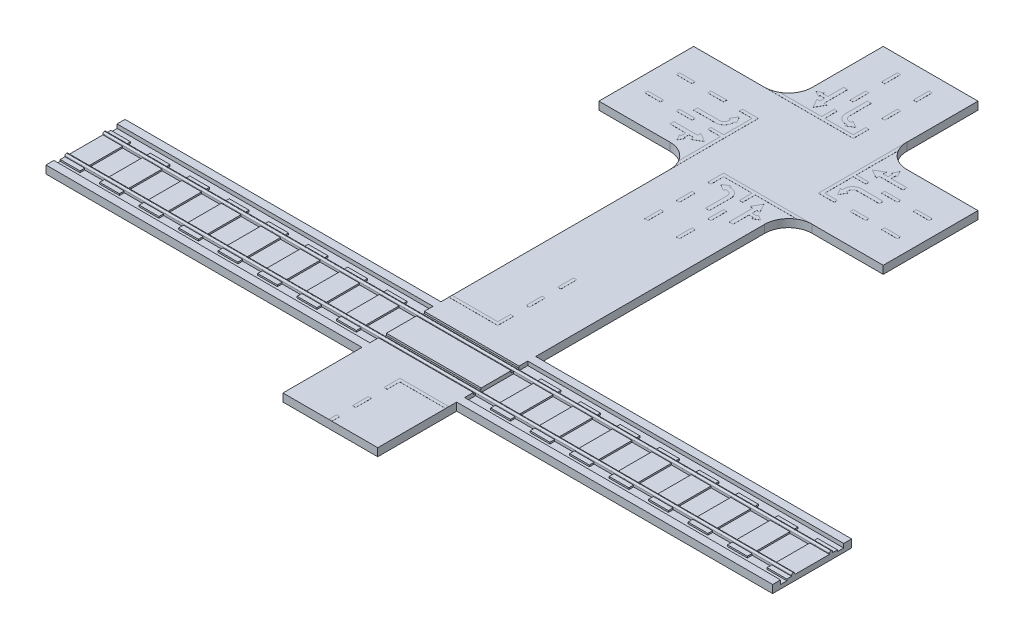
from build123d import *

# Parameters (mm, degrees)
AUFSATZ_LINEAR_AUSTRAGEN1_DEPTH  = 5
VERRUNDUNG1_R                    = 15
SKIZZE2_W                        = 2
SKIZZE2_H                        = 10
SKIZZE2_W_2                      = 10
SKIZZE2_H_2                      = 2
AUFSATZ_LINEAR_AUSTRAGEN2_DEPTH  = 0.05
AUFSATZ_LINEAR_START             = 0.05
AUFSATZ_LINEAR_AUSTRAGEN8_DEPTH  = 0.05
SKIZZE4_W                        = 22
SKIZZE4_H                        = 2
AUFSATZ_LINEAR_AUSTRAGEN13_DEPTH = 0.05
AUFSATZ_LINEAR_AUSTRAGEN14_DEPTH = 0.05
AUFSATZ_LINEAR_AUSTRAGEN15_DEPTH = 5
SKIZZE10_W                       = 29
SKIZZE10_H                       = 2
SKIZZE10_W_2                     = 2
SKIZZE10_H_2                     = 8
SKIZZE10_H_3                     = 10
SKIZZE10_H_4                     = 5
AUFSATZ_LINEAR_AUSTRAGEN17_DEPTH = 0.05
SKIZZE11_W                       = 2
SKIZZE11_H                       = 10
AUFSATZ_LINEAR_AUSTRAGEN18_DEPTH = 0.05
SKIZZE12_W                       = 200
SKIZZE12_H                       = 40
SCHNITT_LINEAR_AUSTRAGEN1_DEPTH  = 2.5
SKIZZE16_W                       = 200
SKIZZE16_H                       = 2
AUFSATZ_LINEAR_AUSTRAGEN20_DEPTH = 2.5
SKIZZE17_W                       = 60
SKIZZE17_H                       = 1.5
SCHNITT_LINEAR_AUSTRAGEN3_DEPTH  = 1.25
SKIZZE18_W                       = 12.5
SKIZZE18_H                       = 32
AUFSATZ_LINEAR_AUSTRAGEN22_DEPTH = 1
VERRUNDUNG2_R                    = 1
VERRUNDUNG3_R                    = 0.25


with BuildPart() as part:
    # Skizze1 → Aufsatz-Linear austragen1 (new body)
    with BuildSketch(Plane(origin=(0, 0, 0), x_dir=(1, 0, 0), z_dir=(0, 1, 0))):
        Polygon((-60, 0), (-120, 0), (-120, 60), (-180, 60), (-180, 120), (-120, 120), (-120, 180), (-60, 180), (-60, 120), (0, 120), (0, 60), (-60, 60), align=None)
    extrude(amount=AUFSATZ_LINEAR_AUSTRAGEN1_DEPTH)

    # Verrundung1
    verrundung1_edges = [part.edges().sort_by_distance(p)[0] for p in [
        (-60, 2.5, -120),
        (-60, 2.5, -60),
        (-120, 2.5, -60),
        (-120, 2.5, -120),
    ]]
    fillet(verrundung1_edges, radius=VERRUNDUNG1_R)

    # Skizze2 → Aufsatz-Linear austragen2 (add)
    with BuildSketch(Plane(origin=(0, 5, 0), x_dir=(1, 0, 0), z_dir=(0, 1, 0))):
        with Locations((-100, 55)):
            Rectangle(SKIZZE2_W, SKIZZE2_H)
        with Locations((-100, 35)):
            Rectangle(SKIZZE2_W, SKIZZE2_H)
        with Locations((-100, 15)):
            Rectangle(SKIZZE2_W, SKIZZE2_H)
        with Locations((-80, 15)):
            Rectangle(SKIZZE2_W, SKIZZE2_H)
        with Locations((-80, 35)):
            Rectangle(SKIZZE2_W, SKIZZE2_H)
        with Locations((-80, 55)):
            Rectangle(SKIZZE2_W, SKIZZE2_H)
        with Locations((-55, 80)):
            Rectangle(SKIZZE2_W_2, SKIZZE2_H_2)
        with Locations((-35, 80)):
            Rectangle(SKIZZE2_W_2, SKIZZE2_H_2)
        with Locations((-15, 80)):
            Rectangle(SKIZZE2_W_2, SKIZZE2_H_2)
        with Locations((-15, 100)):
            Rectangle(SKIZZE2_W_2, SKIZZE2_H_2)
        with Locations((-35, 100)):
            Rectangle(SKIZZE2_W_2, SKIZZE2_H_2)
        with Locations((-55, 100)):
            Rectangle(SKIZZE2_W_2, SKIZZE2_H_2)
        with Locations((-125, 100)):
            Rectangle(SKIZZE2_W_2, SKIZZE2_H_2)
        with Locations((-145, 100)):
            Rectangle(SKIZZE2_W_2, SKIZZE2_H_2)
        with Locations((-165, 100)):
            Rectangle(SKIZZE2_W_2, SKIZZE2_H_2)
        with Locations((-165, 80)):
            Rectangle(SKIZZE2_W_2, SKIZZE2_H_2)
        with Locations((-145, 80)):
            Rectangle(SKIZZE2_W_2, SKIZZE2_H_2)
        with Locations((-125, 80)):
            Rectangle(SKIZZE2_W_2, SKIZZE2_H_2)
        with Locations((-80, 125)):
            Rectangle(SKIZZE2_W, SKIZZE2_H)
        with Locations((-80, 145)):
            Rectangle(SKIZZE2_W, SKIZZE2_H)
        with Locations((-80, 165)):
            Rectangle(SKIZZE2_W, SKIZZE2_H)
        with Locations((-100, 165)):
            Rectangle(SKIZZE2_W, SKIZZE2_H)
        with Locations((-100, 145)):
            Rectangle(SKIZZE2_W, SKIZZE2_H)
        with Locations((-100, 125)):
            Rectangle(SKIZZE2_W, SKIZZE2_H)
    extrude(amount=AUFSATZ_LINEAR_AUSTRAGEN2_DEPTH)

    # Skizze3 → Aufsatz-Linear austragen8 (add)
    with BuildSketch(Plane(origin=(0, 5, 0), x_dir=(1, 0, 0), z_dir=(0, 1, 0)).offset(AUFSATZ_LINEAR_START)):
        with BuildLine():
            Line((-81, 60), (-81, 58))
            Line((-81, 58), (-52.483314774, 58))
            ThreePointArc((-52.483314774, 58), (-48.872983346, 59.491376746), (-45, 60))
            Line((-45, 60), (-81, 60))
        make_face()
        Polygon((-67, 47), (-70, 47), (-70, 50), (-68, 50), (-71.25, 55.629165125), (-74.5, 50), (-72.5, 50), (-72.5, 35), (-70, 35), (-70, 45), (-67, 45), (-67, 44), (-63.535898385, 46), (-67, 48), align=None)
    extrude(amount=-AUFSATZ_LINEAR_AUSTRAGEN8_DEPTH)

    # Skizze4 → Aufsatz-Linear austragen13 (add)
    with BuildSketch(Plane(origin=(0, 5, 0), x_dir=(1, 0, 0), z_dir=(0, 1, 0))):
        with BuildLine():
            ThreePointArc((-87.5, 48.63), (-88.378679656, 50.751320344), (-90.5, 51.63))
            Line((-90.5, 51.63), (-91.5, 51.63))
            Line((-91.5, 51.63), (-91.5, 50.38))
            Line((-91.5, 50.38), (-95.830127019, 52.88))
            Line((-95.830127019, 52.88), (-91.5, 55.38))
            Line((-91.5, 55.38), (-91.5, 54.13))
            Line((-91.5, 54.13), (-90.5, 54.13))
            ThreePointArc((-90.5, 54.13), (-86.610912703, 52.519087297), (-85, 48.63))
            Line((-85, 48.63), (-85, 35))
            Line((-85, 35), (-87.5, 35))
            Line((-87.5, 35), (-87.5, 48.63))
        make_face()
        with Locations((-90, 59)):
            Rectangle(SKIZZE4_W, SKIZZE4_H)
    extrude(amount=AUFSATZ_LINEAR_AUSTRAGEN13_DEPTH)

    # Skizze8 → Aufsatz-Linear austragen14 (add)
    with BuildSketch(Plane(origin=(0, 5, 0), x_dir=(1, 0, 0), z_dir=(0, 1, 0)).offset(AUFSATZ_LINEAR_START)):
        Polygon((-108.763026989, 124.393398282), (-108.736973011, 124.393398282), (-105.5, 130), (-107.5, 130), (-107.5, 145), (-110, 145), (-110, 135), (-113, 135), (-113, 136), (-116.464101615, 134), (-113, 132), (-113, 133), (-110, 133), (-110, 130), (-112, 130), align=None)
        with BuildLine():
            Line((-122, 122), (-127.516685226, 122))
            ThreePointArc((-127.516685226, 122), (-131.127016654, 120.508623254), (-135, 120))
            Line((-135, 120), (-79, 120))
            Line((-79, 120), (-79, 122))
            Line((-79, 122), (-122, 122))
        make_face()
        with BuildLine():
            Line((-88.5, 124.393398282), (-88.460919033, 124.393398282))
            Line((-88.460919033, 124.393398282), (-84.169872981, 126.870834875))
            Line((-84.169872981, 126.870834875), (-88.5, 129.370834875))
            Line((-88.5, 129.370834875), (-88.5, 128.120834875))
            Line((-88.5, 128.120834875), (-89.5, 128.120834875))
            ThreePointArc((-89.5, 128.120834875), (-91.621320344, 128.999514532), (-92.5, 131.120834875))
            Line((-92.5, 131.120834875), (-92.5, 145))
            Line((-92.5, 145), (-95, 145))
            Line((-95, 145), (-95, 131.120834875))
            ThreePointArc((-95, 131.120834875), (-93.389087297, 127.231747579), (-89.5, 125.620834875))
            Line((-89.5, 125.620834875), (-88.5, 125.620834875))
            Line((-88.5, 125.620834875), (-88.5, 124.393398282))
        make_face()
        Polygon((-35, 110), (-35, 107.5), (-50, 107.5), (-50, 105.5), (-55.629165125, 108.75), (-50, 112), (-50, 110), (-47, 110), (-47, 113), (-48, 113), (-46, 116.464101615), (-44, 113), (-45, 113), (-45, 110), align=None)
        with BuildLine():
            Line((-58, 79), (-58, 127.516685226))
            ThreePointArc((-58, 127.516685226), (-59.491376746, 131.127016654), (-60, 135))
            Line((-60, 135), (-60, 79))
            Line((-60, 79), (-58, 79))
        make_face()
        with BuildLine():
            Line((-48.879165125, 95), (-35, 95))
            Line((-35, 95), (-35, 92.5))
            Line((-35, 92.5), (-48.879165125, 92.5))
            ThreePointArc((-48.879165125, 92.5), (-51.000485468, 91.621320344), (-51.879165125, 89.5))
            Line((-51.879165125, 89.5), (-51.879165125, 88.5))
            Line((-51.879165125, 88.5), (-50.629165125, 88.5))
            Line((-50.629165125, 88.5), (-53.129165125, 84.169872981))
            Line((-53.129165125, 84.169872981), (-55.629165125, 88.5))
            Line((-55.629165125, 88.5), (-54.379165125, 88.5))
            Line((-54.379165125, 88.5), (-54.379165125, 89.5))
            ThreePointArc((-54.379165125, 89.5), (-52.768252421, 93.389087297), (-48.879165125, 95))
        make_face()
        with BuildLine():
            ThreePointArc((-120, 45), (-120.508623254, 48.872983346), (-122, 52.483314774))
            Line((-122, 52.483314774), (-122, 101))
            Line((-122, 101), (-120, 101))
            Line((-120, 101), (-120, 45))
        make_face()
        with BuildLine():
            Line((-131.120834875, 85), (-145, 85))
            Line((-145, 85), (-145, 87.5))
            Line((-145, 87.5), (-131.120834875, 87.5))
            ThreePointArc((-131.120834875, 87.5), (-128.999514532, 88.378679656), (-128.120834875, 90.5))
            Line((-128.120834875, 90.5), (-128.120834875, 91.5))
            Line((-128.120834875, 91.5), (-129.370834875, 91.5))
            Line((-129.370834875, 91.5), (-126.870834875, 95.830127019))
            Line((-126.870834875, 95.830127019), (-124.370834875, 91.5))
            Line((-124.370834875, 91.5), (-125.620834875, 91.5))
            Line((-125.620834875, 91.5), (-125.620834875, 90.5))
            ThreePointArc((-125.620834875, 90.5), (-127.231747579, 86.610912703), (-131.120834875, 85))
        make_face()
        Polygon((-145, 70), (-145, 72.5), (-130, 72.5), (-130, 74.5), (-124.370834875, 71.25), (-130, 68), (-130, 70), (-133, 70), (-133, 67), (-132, 67), (-134, 63.535898385), (-136, 67), (-135, 67), (-135, 70), align=None)
    extrude(amount=-AUFSATZ_LINEAR_AUSTRAGEN14_DEPTH)

    # Skizze9 → Aufsatz-Linear austragen15 (add)
    with BuildSketch(Plane(origin=(0, 5, 0), x_dir=(1, 0, 0), z_dir=(0, 1, 0))):
        Polygon((-120, -150), (-320, -150), (-320, -100), (-120, -100), (-120, 0), (-60, 0), (-60, -100), (140, -100), (140, -150), (-60, -150), (-60, -200), (-120, -200), align=None)
    extrude(amount=-AUFSATZ_LINEAR_AUSTRAGEN15_DEPTH)

    # Skizze10 → Aufsatz-Linear austragen17 (add)
    with BuildSketch(Plane(origin=(0, 5, 0), x_dir=(1, 0, 0), z_dir=(0, 1, 0))):
        with Locations((-74.5, -156)):
            Rectangle(SKIZZE10_W, SKIZZE10_H)
        with Locations((-90, -156)):
            Rectangle(SKIZZE10_W_2, SKIZZE10_H)
        with Locations((-90, -161)):
            Rectangle(SKIZZE10_W_2, SKIZZE10_H_2)
        with Locations((-90, -180)):
            Rectangle(SKIZZE10_W_2, SKIZZE10_H_3)
        with Locations((-90, -197.5)):
            Rectangle(SKIZZE10_W_2, SKIZZE10_H_4)
    extrude(amount=AUFSATZ_LINEAR_AUSTRAGEN17_DEPTH)

    # Skizze11 → Aufsatz-Linear austragen18 (add)
    with BuildSketch(Plane(origin=(0, 5, 0), x_dir=(1, 0, 0), z_dir=(0, 1, 0))):
        Polygon((-120, -95), (-89, -95), (-89, -85), (-91, -85), (-91, -93), (-120, -93), align=None)
        with Locations((-90, -70)):
            Rectangle(SKIZZE11_W, SKIZZE11_H)
        with Locations((-90, -50)):
            Rectangle(SKIZZE11_W, SKIZZE11_H)
    extrude(amount=AUFSATZ_LINEAR_AUSTRAGEN18_DEPTH)

    # Skizze12 → Schnitt-Linear austragen1 (cut)
    with BuildSketch(Plane(origin=(0, 5, 0), x_dir=(1, 0, 0), z_dir=(0, 1, 0))):
        with Locations((-220, -125)):
            Rectangle(SKIZZE12_W, SKIZZE12_H)
        with Locations((40, -125)):
            Rectangle(SKIZZE12_W, SKIZZE12_H)
    extrude(amount=-SCHNITT_LINEAR_AUSTRAGEN1_DEPTH, mode=Mode.SUBTRACT)

    # Skizze16 → Aufsatz-Linear austragen20 (add)
    with BuildSketch(Plane(origin=(0, 2.5, 0), x_dir=(1, 0, 0), z_dir=(0, 1, 0))):
        with Locations((-220, -113)):
            Rectangle(SKIZZE16_W, SKIZZE16_H)
        with Locations((-220, -137)):
            Rectangle(SKIZZE16_W, SKIZZE16_H)
        with Locations((40, -113)):
            Rectangle(SKIZZE16_W, SKIZZE16_H)
        with Locations((40, -137)):
            Rectangle(SKIZZE16_W, SKIZZE16_H)
    extrude(amount=AUFSATZ_LINEAR_AUSTRAGEN20_DEPTH)

    # Skizze17 → Schnitt-Linear austragen3 (cut)
    with BuildSketch(Plane(origin=(0, 5, 0), x_dir=(1, 0, 0), z_dir=(0, 1, 0))):
        with Locations((-90, -111.25)):
            Rectangle(SKIZZE17_W, SKIZZE17_H)
        with Locations((-90, -114.75)):
            Rectangle(SKIZZE17_W, SKIZZE17_H)
        with Locations((-90, -135.25)):
            Rectangle(SKIZZE17_W, SKIZZE17_H)
        with Locations((-90, -138.75)):
            Rectangle(SKIZZE17_W, SKIZZE17_H)
    extrude(amount=-SCHNITT_LINEAR_AUSTRAGEN3_DEPTH, mode=Mode.SUBTRACT)

    # Skizze18 → Aufsatz-Linear austragen22 (add)
    with BuildSketch(Plane(origin=(0, 2.5, 0), x_dir=(1, 0, 0), z_dir=(0, 1, 0))):
        with Locations((-238.75, -125)):
            Rectangle(SKIZZE18_W, SKIZZE18_H)
        with Locations((-213.75, -125)):
            Rectangle(SKIZZE18_W, SKIZZE18_H)
        with Locations((-188.75, -125)):
            Rectangle(SKIZZE18_W, SKIZZE18_H)
        with Locations((-163.75, -125)):
            Rectangle(SKIZZE18_W, SKIZZE18_H)
        with Locations((-138.75, -125)):
            Rectangle(SKIZZE18_W, SKIZZE18_H)
        with Locations((83.75, -125)):
            Rectangle(SKIZZE18_W, SKIZZE18_H)
        with Locations((58.75, -125)):
            Rectangle(SKIZZE18_W, SKIZZE18_H)
        with Locations((33.75, -125)):
            Rectangle(SKIZZE18_W, SKIZZE18_H)
        with Locations((8.75, -125)):
            Rectangle(SKIZZE18_W, SKIZZE18_H)
        with Locations((-16.25, -125)):
            Rectangle(SKIZZE18_W, SKIZZE18_H)
        with Locations((-41.25, -125)):
            Rectangle(SKIZZE18_W, SKIZZE18_H)
        with Locations((133.75, -125)):
            Rectangle(SKIZZE18_W, SKIZZE18_H)
        with Locations((108.75, -125)):
            Rectangle(SKIZZE18_W, SKIZZE18_H)
        with Locations((-263.75, -125)):
            Rectangle(SKIZZE18_W, SKIZZE18_H)
        with Locations((-288.75, -125)):
            Rectangle(SKIZZE18_W, SKIZZE18_H)
        with Locations((-313.75, -125)):
            Rectangle(SKIZZE18_W, SKIZZE18_H)
    extrude(amount=AUFSATZ_LINEAR_AUSTRAGEN22_DEPTH)

    # Verrundung2
    verrundung2_edges = [part.edges().sort_by_distance(p)[0] for p in [
        (-90, 5, 138),
        (-90, 5, 136),
        (-90, 5, 114),
        (-90, 5, 112),
    ]]
    fillet(verrundung2_edges, radius=VERRUNDUNG2_R - 0.0001)  # a hair under: the kernel refuses the full size

    # Verrundung3
    verrundung3_edges = [part.edges().sort_by_distance(p)[0] for p in [
        (-90, 3.75, 136),
        (-90, 3.75, 138),
        (-90, 3.75, 112),
        (-90, 3.75, 114),
    ]]
    fillet(verrundung3_edges, radius=VERRUNDUNG3_R)


solid = part.part
